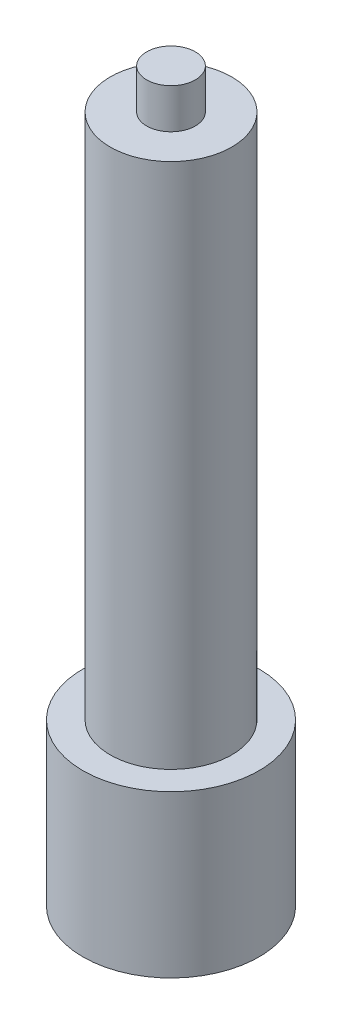
from build123d import *


with BuildPart() as part:
    # Sketch2 → Revolve1 (revolve)
    with BuildSketch(Plane.XY):
        Polygon((0, 0), (0, 190), (6.35, 190), (6.35, 179.568098512), (15.875, 179.568098512), (15.875, 42.120572592), (23, 42.120572592), (23, 0), align=None)
    revolve(axis=Axis((0, 0, 0), (0, 1, 0)))


solid = part.part
